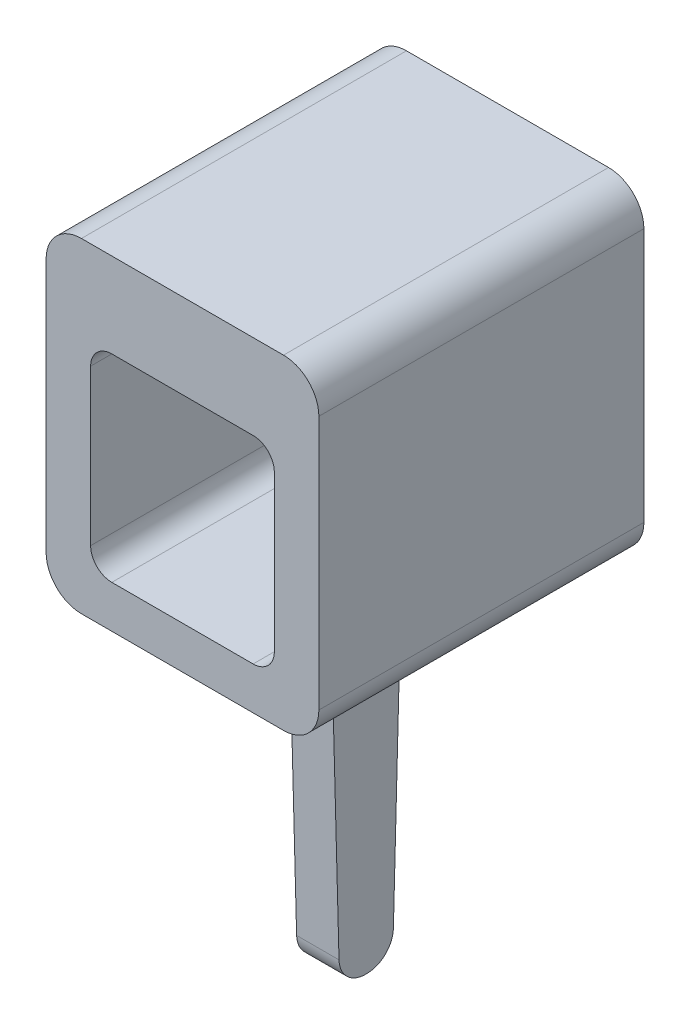
from build123d import *

# Parameters (mm, degrees)
SKETCH_1_W          = 3.86
SKETCH_1_H          = 4.6
EXTRUDE_1_DEPTH     = 4.6
SKETCH_2_W          = 2.6
SKETCH_2_H          = 2.8
CUT_EXTRUDE_1_DEPTH = 7.785639248
FILLET_1_R          = 0.5
FILLET_2_R          = 0.3
SKETCH_3_W          = 0.6
SKETCH_3_H          = 1
EXTRUDE_2_DEPTH     = 4.7
CHAMFER_1_SIZE      = 4.7
CHAMFER_1_SIZE_2    = 0.125
FILLET_4_R          = 0.375


with BuildPart() as part:
    # Эскиз1 → Бобышка-Вытянуть1 (new body)
    with BuildSketch(Plane(origin=(0, 0, 0), x_dir=(1, 0, 0), z_dir=(0, 1, 0))):
        Rectangle(SKETCH_1_W, SKETCH_1_H)
    extrude(amount=EXTRUDE_1_DEPTH)

    # Эскиз2 → Вырез-Вытянуть1 (cut, through all)
    with BuildSketch(Plane.XY.offset(2.3)):
        with Locations((0, 2)):
            Rectangle(SKETCH_2_W, SKETCH_2_H)
    extrude(amount=-CUT_EXTRUDE_1_DEPTH, mode=Mode.SUBTRACT)

    # Скругление1
    fillet_1_edges = [part.edges().sort_by_distance(p)[0] for p in [
        (1.93, 4.6, 0),
        (-1.93, 4.6, 0),
        (1.93, 0, 0),
        (-1.93, 0, 0),
    ]]
    fillet(fillet_1_edges, radius=FILLET_1_R)

    # Скругление2
    fillet_2_edges = [part.edges().sort_by_distance(p)[0] for p in [
        (-1.3, 0.6, 0),
        (-1.3, 3.4, 0),
        (1.3, 3.4, 0),
        (1.3, 0.6, 0),
    ]]
    fillet(fillet_2_edges, radius=FILLET_2_R)

    # Эскиз3 → Бобышка-Вытянуть2 (add)
    with BuildSketch(Plane.XZ):
        Rectangle(SKETCH_3_W, SKETCH_3_H)
    extrude(amount=EXTRUDE_2_DEPTH)

    # Фаска1
    # the kernel refuses this chamfer: 4.7, 0.125 mm, written as the material it takes off along each edge
    with BuildSketch(Plane(origin=(-12.519840253, -4.7, 0.5), x_dir=(0, 0.9999994771802269, 0.0010225650458134765), z_dir=(1, 0, 0))) as chamfer_1_piece_1_section:
        Polygon((CHAMFER_1_SIZE * 0.99999947718, -CHAMFER_1_SIZE * 0.00102256504581), (-CHAMFER_1_SIZE_2 * 0.00102256504581, -CHAMFER_1_SIZE_2 * 0.99999947718), (0, 0), align=None)
    chamfer_1_piece_1 = extrude(amount=25.039680507, mode=Mode.PRIVATE)
    chamfer_1_piece_1 = split(chamfer_1_piece_1, bisect_by=Plane(origin=(0, 0, 0.511194246), z_dir=(0, -1, 0)), keep=Keep.TOP, mode=Mode.PRIVATE)
    add(chamfer_1_piece_1, mode=Mode.SUBTRACT)
    with BuildSketch(Plane(origin=(12.519840253, -4.7, -0.5), x_dir=(0, 0.9999994771802269, -0.0010225650458134765), z_dir=(-1, 0, 0))) as chamfer_1_piece_2_section:
        Polygon((CHAMFER_1_SIZE * 0.99999947718, -CHAMFER_1_SIZE * 0.00102256504581), (-CHAMFER_1_SIZE_2 * 0.00102256504581, -CHAMFER_1_SIZE_2 * 0.99999947718), (0, 0), align=None)
    chamfer_1_piece_2 = extrude(amount=25.039680507, mode=Mode.PRIVATE)
    chamfer_1_piece_2 = split(chamfer_1_piece_2, bisect_by=Plane(origin=(0, 0, -0.511194246), z_dir=(0, -1, 0)), keep=Keep.TOP, mode=Mode.PRIVATE)
    add(chamfer_1_piece_2, mode=Mode.SUBTRACT)

    # Скругление4
    fillet_4_edges = [part.edges().sort_by_distance(p)[0] for p in [
        (0, -4.7, -0.375),
        (0, -4.7, 0.375),
    ]]
    fillet(fillet_4_edges, radius=FILLET_4_R)


solid = part.part
